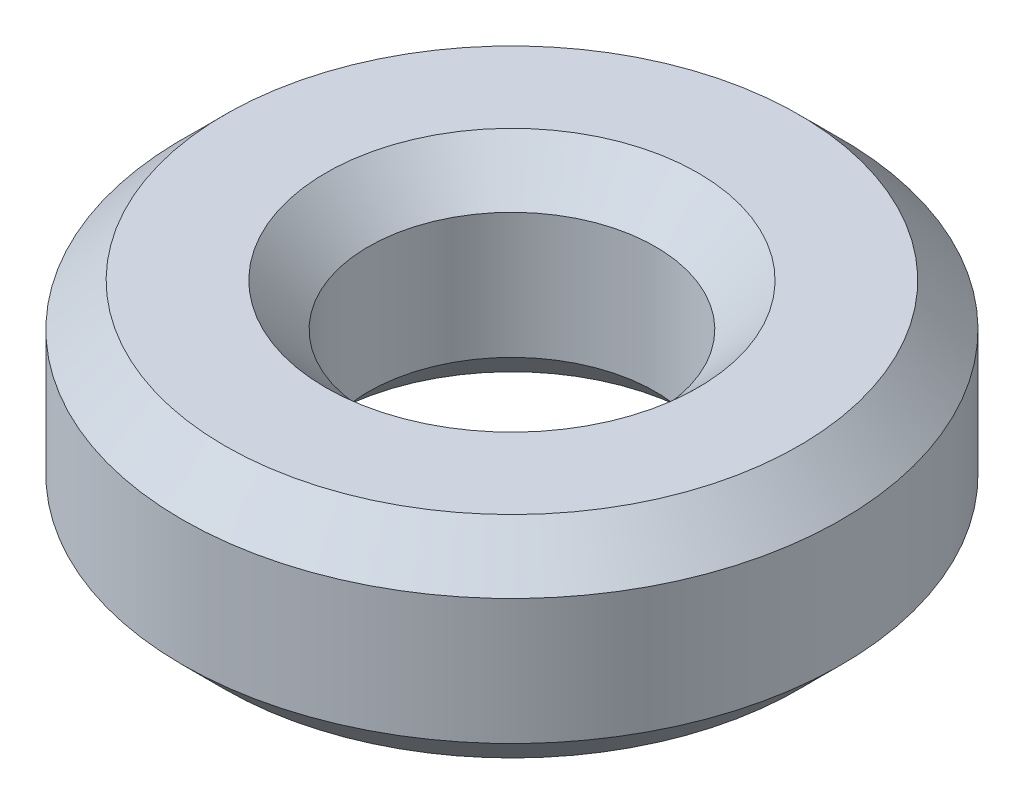
from build123d import *

# Parameters (mm, degrees)
SKETCH1_R           = 20
BOSS_EXTRUDE1_DEPTH = 12.793794057
SKETCH2_R           = 8.707332935
CUT_EXTRUDE1_DEPTH  = 32.043214498
CHAMFER1_SIZE       = 2.585183214


with BuildPart() as part:
    # Sketch1 → Boss-Extrude1 (new body)
    with BuildSketch(Plane(origin=(0, 0, 0), x_dir=(1, 0, 0), z_dir=(0, 1, 0))):
        Circle(SKETCH1_R)
    extrude(amount=BOSS_EXTRUDE1_DEPTH)

    # Sketch2 → Cut-Extrude1 (cut, through all)
    with BuildSketch(Plane(origin=(0, 0, 0), x_dir=(1, 0, 0), z_dir=(0, 1, 0))):
        Circle(SKETCH2_R)
    extrude(amount=CUT_EXTRUDE1_DEPTH, mode=Mode.SUBTRACT)

    # Chamfer1
    chamfer1_edges = [part.edges().sort_by_distance(p)[0] for p in [
        (-8.707332935, 12.793794057, 0),
        (-8.707332935, 0, 0),
        (-20, 0, 0),
        (-20, 12.793794057, 0),
    ]]
    chamfer(chamfer1_edges, length=CHAMFER1_SIZE)


solid = part.part
